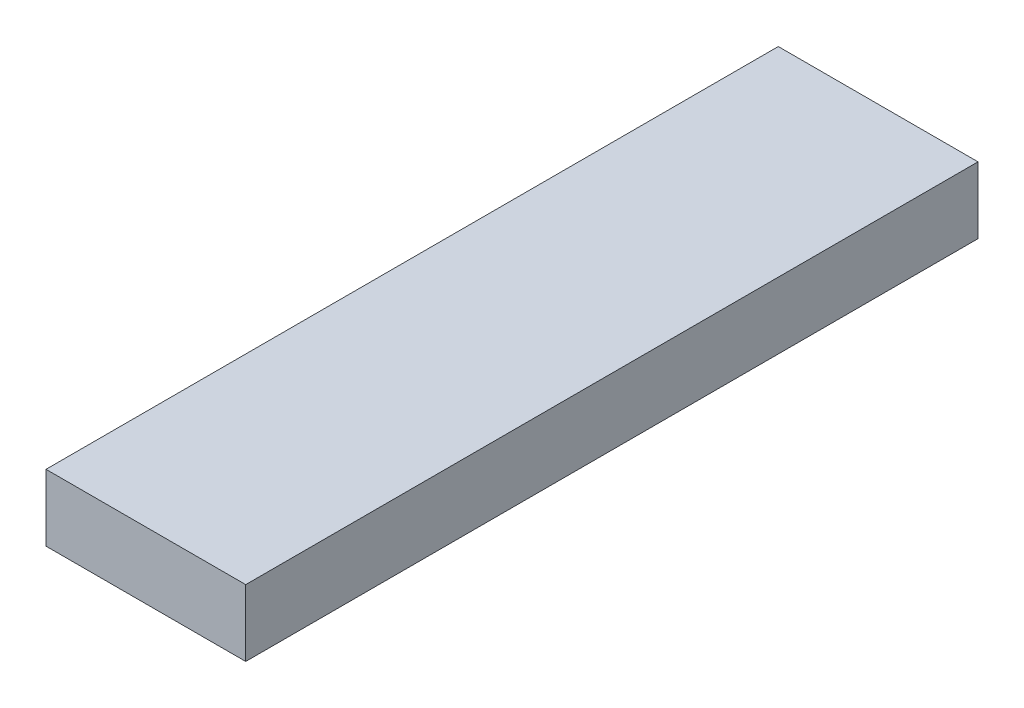
from build123d import *

# Parameters (mm, degrees)
SKETCH1_W           = 90
SKETCH1_H           = 30
BOSS_EXTRUDE1_DEPTH = 165


with BuildPart() as part:
    # Sketch1 → Boss-Extrude1 (new, symmetric)
    with BuildSketch(Plane.XY):
        Rectangle(SKETCH1_W, SKETCH1_H)
    extrude(amount=BOSS_EXTRUDE1_DEPTH, both=True)


solid = part.part
